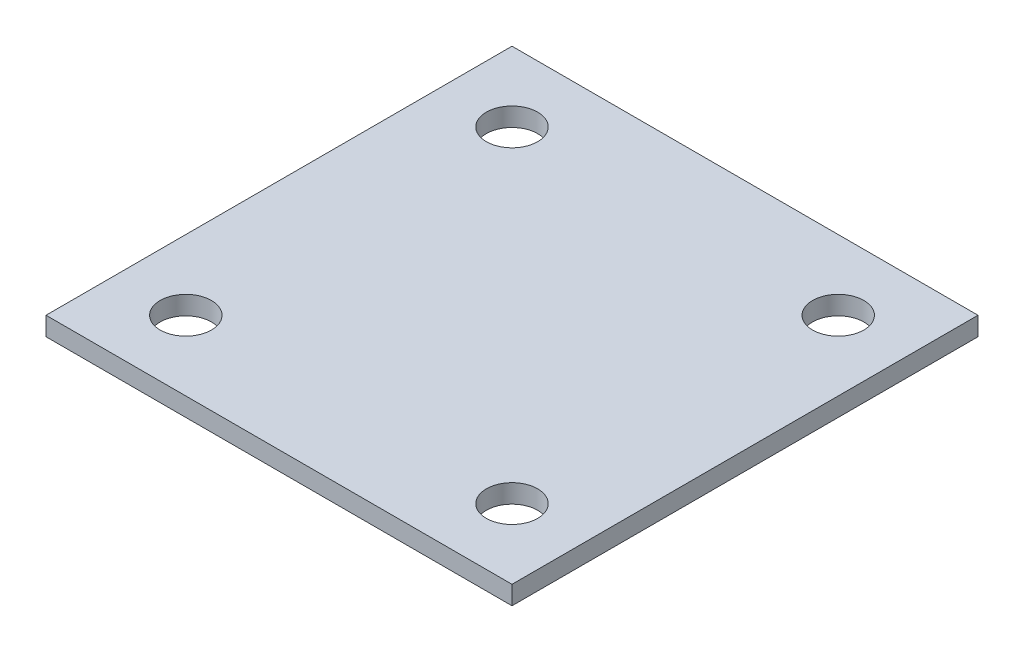
from build123d import *

# Parameters (mm, degrees)
SKETCH_1_W                   = 100
SKETCH_1_H                   = 100
SKETCH_1_R                   = 5.5
EXTRUDE_100_100_4_4_11_DEPTH = 4


with BuildPart() as part:
    # Эскиз1 → Пластина 100х100х4, 4 отв. Ø11 (new body)
    with BuildSketch(Plane(origin=(0, 0, 0), x_dir=(1, 0, 0), z_dir=(0, 1, 0))):
        Rectangle(SKETCH_1_W, SKETCH_1_H)
        with Locations((-35, -35)):
            Circle(SKETCH_1_R, mode=Mode.SUBTRACT)
        with Locations((-35, 35)):
            Circle(SKETCH_1_R, mode=Mode.SUBTRACT)
        with Locations((35, -35)):
            Circle(SKETCH_1_R, mode=Mode.SUBTRACT)
        with Locations((35, 35)):
            Circle(SKETCH_1_R, mode=Mode.SUBTRACT)
    extrude(amount=EXTRUDE_100_100_4_4_11_DEPTH)


solid = part.part
